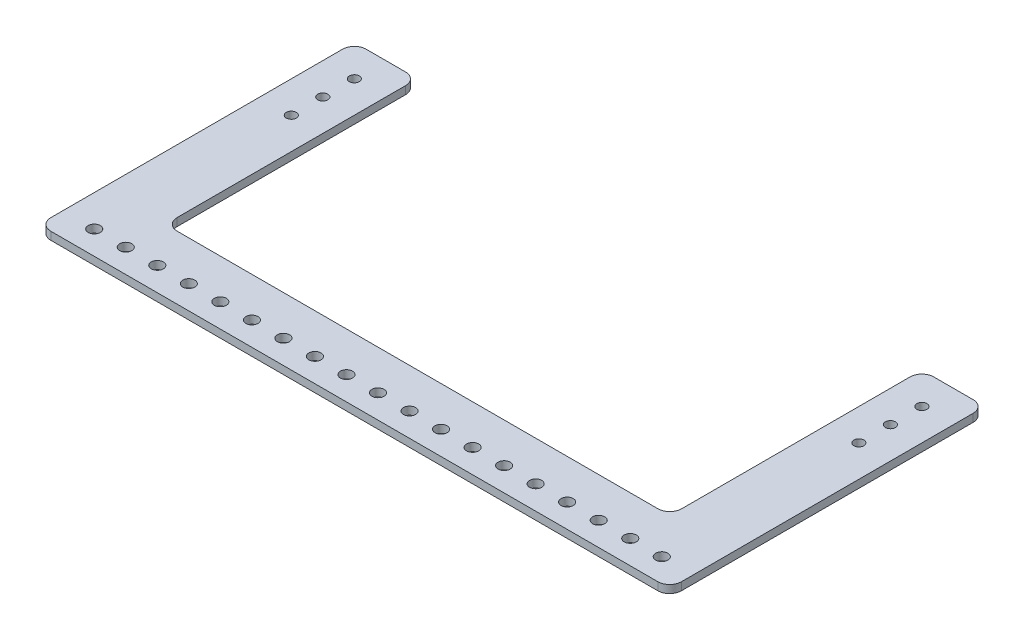
from build123d import *

# Parameters (mm, degrees)
SKETCH2_R           = 2.0193
BOSS_EXTRUDE1_DEPTH = 3.175
FILLET1_R           = 4.7625
SKETCH3_R           = 2.4384
CUT_EXTRUDE1_DEPTH  = 143.025809714


with BuildPart() as part:
    # Sketch2 → Boss-Extrude1 (new body)
    with BuildSketch(Plane(origin=(0, 0, 0), x_dir=(1, 0, 0), z_dir=(0, 1, 0))):
        Polygon((-127, 63.5), (-127, -63.5), (127, -63.5), (127, 63.5), (101.6, 63.5), (101.6, -38.0365), (-101.6, -38.0365), (-101.6, 63.5), align=None)
        with Locations((-114.3, 25.4)):
            Circle(SKETCH2_R, mode=Mode.SUBTRACT)
        with Locations((-114.3, 38.1)):
            Circle(SKETCH2_R, mode=Mode.SUBTRACT)
        with Locations((-114.3, 50.8)):
            Circle(SKETCH2_R, mode=Mode.SUBTRACT)
        with Locations((114.3, 25.4)):
            Circle(SKETCH2_R, mode=Mode.SUBTRACT)
        with Locations((114.3, 38.1)):
            Circle(SKETCH2_R, mode=Mode.SUBTRACT)
        with Locations((114.3, 50.8)):
            Circle(SKETCH2_R, mode=Mode.SUBTRACT)
    extrude(amount=BOSS_EXTRUDE1_DEPTH)

    # Fillet1
    fillet1_edges = [part.edges().sort_by_distance(p)[0] for p in [
        (127, 1.5875, -63.5),
        (-127, 1.5875, 63.5),
        (-127, 1.5875, -63.5),
        (-101.6, 1.5875, -63.5),
        (-101.6, 1.5875, 38.0365),
        (101.6, 1.5875, 38.0365),
        (101.6, 1.5875, -63.5),
        (127, 1.5875, 63.5),
    ]]
    fillet(fillet1_edges, radius=FILLET1_R)

    # Sketch3 → Cut-Extrude1 (cut, through all)
    with BuildSketch(Plane(origin=(0, 3.175, 0), x_dir=(1, 0, 0), z_dir=(0, 1, 0))):
        with Locations((-114.3, -53.975)):
            Circle(SKETCH3_R)
        with Locations((-101.6, -53.975)):
            Circle(SKETCH3_R)
        with Locations((-88.9, -53.975)):
            Circle(SKETCH3_R)
        with Locations((-76.2, -53.975)):
            Circle(SKETCH3_R)
        with Locations((-63.5, -53.975)):
            Circle(SKETCH3_R)
        with Locations((-50.8, -53.975)):
            Circle(SKETCH3_R)
        with Locations((-38.1, -53.975)):
            Circle(SKETCH3_R)
        with Locations((-25.4, -53.975)):
            Circle(SKETCH3_R)
        with Locations((-12.7, -53.975)):
            Circle(SKETCH3_R)
        with Locations((0, -53.975)):
            Circle(SKETCH3_R)
        with Locations((12.7, -53.975)):
            Circle(SKETCH3_R)
        with Locations((25.4, -53.975)):
            Circle(SKETCH3_R)
        with Locations((38.1, -53.975)):
            Circle(SKETCH3_R)
        with Locations((50.8, -53.975)):
            Circle(SKETCH3_R)
        with Locations((63.5, -53.975)):
            Circle(SKETCH3_R)
        with Locations((76.2, -53.975)):
            Circle(SKETCH3_R)
        with Locations((88.9, -53.975)):
            Circle(SKETCH3_R)
        with Locations((101.6, -53.975)):
            Circle(SKETCH3_R)
        with Locations((114.3, -53.975)):
            Circle(SKETCH3_R)
    extrude(amount=-CUT_EXTRUDE1_DEPTH, mode=Mode.SUBTRACT)


solid = part.part
